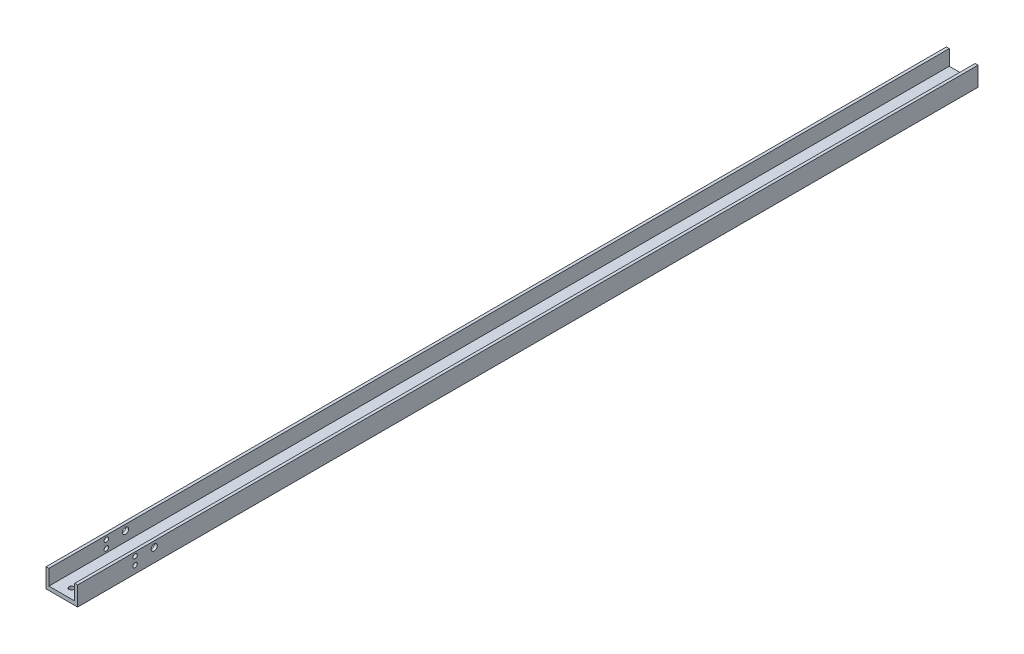
from build123d import *

# Parameters (mm, degrees)
BOSS_EXTRU_1_DEPTH                        = 470
ESQUISSE2_R                               = 1.15
ESQUISSE2_R_2                             = 1.6
ENL_V_MAT_EXTRU_1_DEPTH                   = 471.395843944
TROU_POUR_TARAUDAGE_POUR_TROU_TARAUD_M3_D = 2.5


with BuildPart() as part:
    # Esquisse1 → Boss.-Extru.1 (new body)
    with BuildSketch(Plane.XY):
        Polygon((-8.25, 0), (8.25, 0), (8.25, 10), (6.75, 10), (6.75, 2), (-6.75, 2), (-6.75, 10), (-8.25, 10), align=None)
    extrude(amount=BOSS_EXTRU_1_DEPTH)

    # Esquisse2 → Enlèv. mat.-Extru.1 (cut, through all)
    with BuildSketch(Plane(origin=(8.25, 0, 0), x_dir=(0, 0, -1), z_dir=(1, 0, 0))):
        with Locations((-440, 8)):
            Circle(ESQUISSE2_R)
        with Locations((-440, 4)):
            Circle(ESQUISSE2_R)
        with Locations((-430, 7)):
            Circle(ESQUISSE2_R_2)
    extrude(amount=-ENL_V_MAT_EXTRU_1_DEPTH, mode=Mode.SUBTRACT)

    # Trou pour taraudage pour trou taraudé M31 (through all)
    with Locations(Plane(origin=(0, 2, 0), x_dir=(1, 0, 0), z_dir=(0, 1, 0))):
        with Locations((0, -465)):
            Hole(TROU_POUR_TARAUDAGE_POUR_TROU_TARAUD_M3_D / 2)


solid = part.part
